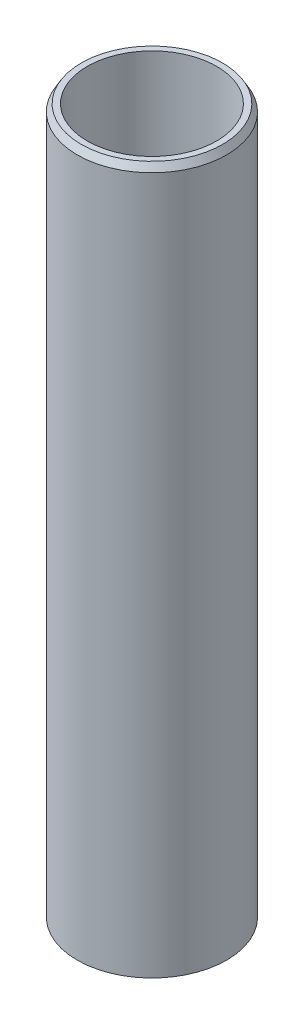
from build123d import *
from OCP.BRepFilletAPI import BRepFilletAPI_MakeChamfer

# Parameters (mm, degrees)
SKETCH1_R           = 57.5
BOSS_EXTRUDE1_DEPTH = 545.314212117
SKETCH2_R           = 49.799231247
CUT_EXTRUDE1_DEPTH  = 552.34389444
CHAMFER1_SIZE       = 5.428025902
CHAMFER1_SIZE2      = 3.133872215


with BuildPart() as part:
    # Sketch1 → Boss-Extrude1 (new body)
    with BuildSketch(Plane(origin=(0, 0, 0), x_dir=(1, 0, 0), z_dir=(0, 1, 0))):
        Circle(SKETCH1_R)
    extrude(amount=BOSS_EXTRUDE1_DEPTH)

    # Sketch2 → Cut-Extrude1 (cut, through all)
    with BuildSketch(Plane(origin=(0, 0, 0), x_dir=(1, 0, 0), z_dir=(0, 1, 0))):
        Circle(SKETCH2_R)
    extrude(amount=CUT_EXTRUDE1_DEPTH, mode=Mode.SUBTRACT)

    # Chamfer1: one chamfer whose edges measure the first distance from different faces: ONE call of the kernel's chamfer builder (chamfer() names one face for all edges)
    chamfer1_edges_1 = [part.edges().sort_by_distance(p)[0] for p in [
        (-57.5, 545.314212117, 0),
    ]]
    chamfer1_side_1 = [part.faces().sort_by_distance(p)[0] for p in [
        (-57.5, 272.657106058, 0),
    ]]
    chamfer1_edges_2 = [part.edges().sort_by_distance(p)[0] for p in [
        (-57.5, 0, 0),
    ]]
    chamfer1_side_2 = [part.faces().sort_by_distance(p)[0] for p in [
        (-55.873654403, 0, 0),
    ]]
    chamfer1 = BRepFilletAPI_MakeChamfer(part.part.solid().wrapped)
    for e in chamfer1_edges_1:
        chamfer1.Add(CHAMFER1_SIZE, CHAMFER1_SIZE2, e.wrapped, chamfer1_side_1[0].wrapped)  # the first distance lies on this face
    for e in chamfer1_edges_2:
        chamfer1.Add(CHAMFER1_SIZE, CHAMFER1_SIZE2, e.wrapped, chamfer1_side_2[0].wrapped)  # the first distance lies on this face
    add(Compound.cast(chamfer1.Shape()), mode=Mode.REPLACE)


solid = part.part
